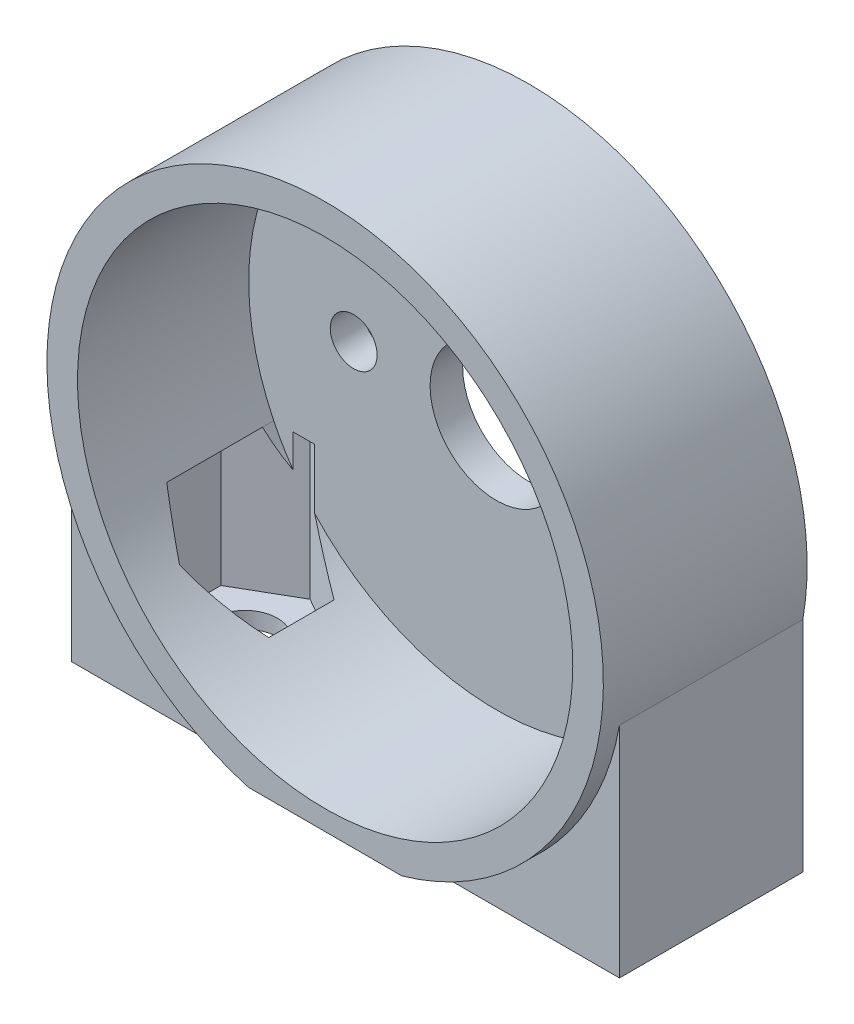
from build123d import *

# Parameters (mm, degrees)
SKETCH1_R           = 13.65
SKETCH1_R_2         = 12.15
BOSS_EXTRUDE1_DEPTH = 10
BOSS_EXTRUDE3_DEPTH = 9
SKETCH5_R           = 1.6
CUT_EXTRUDE1_DEPTH  = 7
SKETCH6_W           = 26.88
SKETCH6_H           = 0.53
CUT_EXTRUDE2_DEPTH  = 22.740400289
SKETCH7_R           = 12.15
SKETCH7_R_2         = 1.15
SKETCH7_R_3         = 3.25
BOSS_EXTRUDE4_DEPTH = 1.6
CUT_EXTRUDE4_START  = -0.8
CUT_EXTRUDE4_DEPTH  = 7


with BuildPart() as part:
    # Sketch1 → Boss-Extrude1 (new body)
    with BuildSketch(Plane.XY):
        Circle(SKETCH1_R)
        Circle(SKETCH1_R_2, mode=Mode.SUBTRACT)
    extrude(amount=BOSS_EXTRUDE1_DEPTH)

    # Sketch3 → Boss-Extrude3 (add)
    with BuildSketch(Plane(origin=(0, 0, 0), x_dir=(-1, 0, 0), z_dir=(0, 0, -1))):
        with BuildLine():
            ThreePointArc((1e-08, -13.65), (-8.768275723, -10.461349857), (-13.44, -2.385141505))
            Line((-13.44, -2.385141505), (-13.44, -13.65))
            Line((-13.44, -13.65), (1e-08, -13.65))
        make_face()
        with BuildLine():
            ThreePointArc((13.44, -2.385141505), (8.768275731, -10.461349851), (1e-08, -13.65))
            Line((1e-08, -13.65), (13.44, -13.65))
            Line((13.44, -13.65), (13.44, -2.385141505))
        make_face()
    extrude(amount=-BOSS_EXTRUDE3_DEPTH)

    # Sketch5 → Cut-Extrude1 (cut)
    with BuildSketch(Plane.XZ.offset(13.65)):
        with Locations((-9.44, 4.5)):
            Circle(SKETCH5_R)
        with Locations((9.44, 4.5)):
            Circle(SKETCH5_R)
    extrude(amount=-CUT_EXTRUDE1_DEPTH, mode=Mode.SUBTRACT)

    # Sketch6 → Cut-Extrude2 (cut, through all)
    with BuildSketch(Plane(origin=(0, 0, 0), x_dir=(-1, 0, 0), z_dir=(0, 0, -1))):
        with Locations((0, -13.385)):
            Rectangle(SKETCH6_W, SKETCH6_H)
    extrude(amount=-CUT_EXTRUDE2_DEPTH, mode=Mode.SUBTRACT)

    # Sketch7 → Boss-Extrude4 (add)
    with BuildSketch(Plane(origin=(0, 0, 0), x_dir=(-1, 0, 0), z_dir=(0, 0, -1))):
        Circle(SKETCH7_R)
        with Locations((-7, 0)):
            Circle(SKETCH7_R_2, mode=Mode.SUBTRACT)
        with Locations((7, 0)):
            Circle(SKETCH7_R_2, mode=Mode.SUBTRACT)
        Circle(SKETCH7_R_3, mode=Mode.SUBTRACT)
    extrude(amount=-BOSS_EXTRUDE4_DEPTH)

    # Sketch8 → Cut-Extrude4 (cut)
    with BuildSketch(Plane.XZ.offset(13.12).offset(CUT_EXTRUDE4_START)):
        Polygon((-12.215, 2.897853003), (-9.44, 1.295706006), (-6.665, 2.897853003), (-6.665, 6.102146997), (-9.44, 7.704293994), (-12.215, 6.102146997), align=None)
        Polygon((12.215, 6.102146997), (12.215, 2.897853003), (9.44, 1.295706006), (6.665, 2.897853003), (6.665, 6.102146997), (9.44, 7.704293994), align=None)
    extrude(amount=-CUT_EXTRUDE4_DEPTH, mode=Mode.SUBTRACT)


solid = part.part
